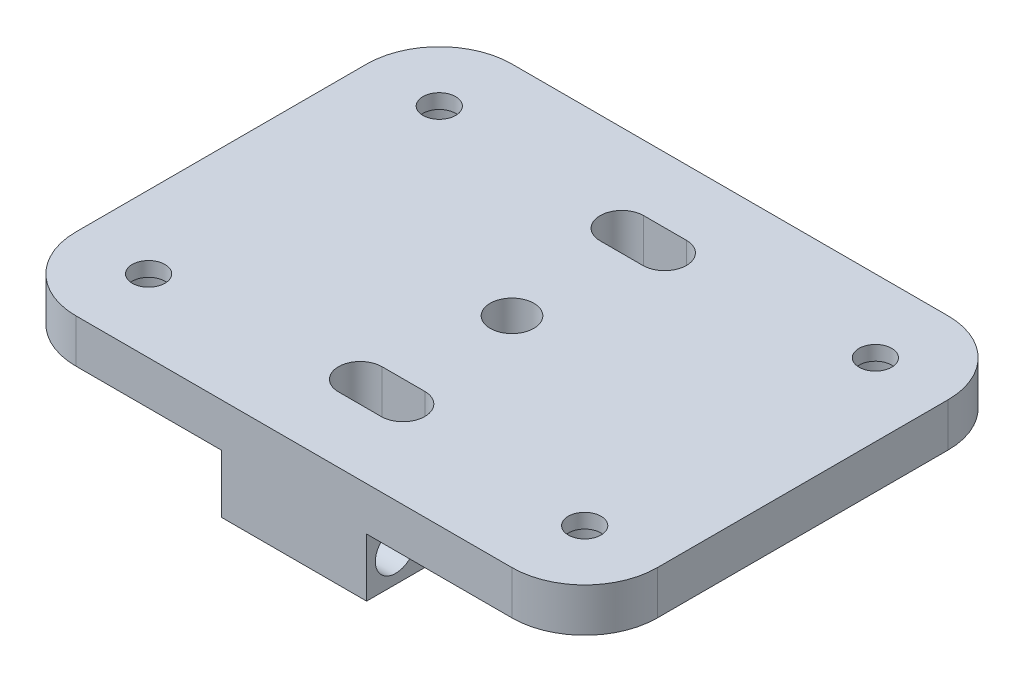
from build123d import *

# Parameters (mm, degrees)
ESQUISSE1_R              = 2.25
ESQUISSE1_R_2            = 3
BOSS_EXTRU_3_DEPTH       = 6
BOSS_EXTRU_4_START       = 8
ESQUISSE2_W              = 20
ESQUISSE2_H              = 60
ESQUISSE2_R              = 3
BOSS_EXTRU_4_DEPTH       = 8
ESQUISSE3_R              = 4
ENL_V_MAT_EXTRU_2_DEPTH  = 4
ESQUISSE7_R              = 2.8
ENL_V_MAT_EXTRU_8_DEPTH  = 8.1
ENL_V_MAT_EXTRU_9_DEPTH  = 52.923019943
ESQUISSE9_R              = 2.8
ENL_V_MAT_EXTRU_10_DEPTH = 8.1


with BuildPart() as part:
    # Esquisse1 → Boss.-Extru.3 (new body)
    with BuildSketch(Plane(origin=(0, 0, 0), x_dir=(1, 0, 0), z_dir=(0, 1, 0))):
        with BuildLine():
            Line((-29.104707822, 30), (-30, 30))
            ThreePointArc((-30, 30), (-37.071067812, 27.071067812), (-40, 20))
            Line((-40, 20), (-40, -20))
            ThreePointArc((-40, -20), (-37.071067812, -27.071067812), (-30, -30))
            Line((-30, -30), (-29.104707822, -30))
            Line((-29.104707822, -30), (-9.104707822, -30))
            Line((-9.104707822, -30), (30, -30))
            ThreePointArc((30, -30), (37.071067812, -27.071067812), (40, -20))
            Line((40, -20), (40, 20))
            ThreePointArc((40, 20), (37.071067812, 27.071067812), (30, 30))
            Line((30, 30), (-9.104707822, 30))
            Line((-9.104707822, 30), (-29.104707822, 30))
        make_face()
        with Locations((-30, -20)):
            Circle(ESQUISSE1_R, mode=Mode.SUBTRACT)
        with Locations((30, -20)):
            Circle(ESQUISSE1_R, mode=Mode.SUBTRACT)
        Circle(ESQUISSE1_R_2, mode=Mode.SUBTRACT)
        with Locations((-30, 20)):
            Circle(ESQUISSE1_R, mode=Mode.SUBTRACT)
        with Locations((30, 20)):
            Circle(ESQUISSE1_R, mode=Mode.SUBTRACT)
    extrude(amount=BOSS_EXTRU_3_DEPTH)

    # Esquisse2 → Boss.-Extru.4 (add)
    with BuildSketch(Plane.XZ.offset(BOSS_EXTRU_4_START)):
        Rectangle(ESQUISSE2_W, ESQUISSE2_H)
        Circle(ESQUISSE2_R, mode=Mode.SUBTRACT)
    extrude(amount=-BOSS_EXTRU_4_DEPTH)

    # Esquisse3 → Enlèv. mat.-Extru.2 (cut)
    with BuildSketch(Plane.XZ):
        with Locations((-30, 20)):
            Circle(ESQUISSE3_R)
        with Locations((-30, -20)):
            Circle(ESQUISSE3_R)
        with Locations((30, 20)):
            Circle(ESQUISSE3_R)
        with Locations((30, -20)):
            Circle(ESQUISSE3_R)
    extrude(amount=-ENL_V_MAT_EXTRU_2_DEPTH, mode=Mode.SUBTRACT)

    # Esquisse7 → Enlèv. mat.-Extru.8 (cut)
    with BuildSketch(Plane.ZY.offset(10)):
        with Locations((26, -3.87740141)):
            Circle(ESQUISSE7_R)
        with Locations((-26, -3.87740141)):
            Circle(ESQUISSE7_R)
    extrude(amount=-ENL_V_MAT_EXTRU_8_DEPTH, mode=Mode.SUBTRACT)

    # Esquisse8 → Enlèv. mat.-Extru.9 (cut, through all)
    with BuildSketch(Plane.XZ.offset(8)):
        with BuildLine():
            Line((-2.879526134, 21), (3, 21))
            ThreePointArc((3, 21), (6, 18), (3, 15))
            Line((3, 15), (-2.879526134, 15))
            ThreePointArc((-2.879526134, 15), (-5.879526134, 18), (-2.879526134, 21))
        make_face()
        with BuildLine():
            Line((-2.879526134, -15), (3, -15))
            ThreePointArc((3, -15), (6, -18), (3, -21))
            Line((3, -21), (-2.879526134, -21))
            ThreePointArc((-2.879526134, -21), (-5.879526134, -18), (-2.879526134, -15))
        make_face()
    extrude(amount=-ENL_V_MAT_EXTRU_9_DEPTH, mode=Mode.SUBTRACT)

    # Esquisse9 → Enlèv. mat.-Extru.10 (cut)
    with BuildSketch(Plane(origin=(10, 0, 0), x_dir=(0, 0, -1), z_dir=(1, 0, 0))):
        with Locations((-26, -3.88)):
            Circle(ESQUISSE9_R)
        with Locations((26, -3.88)):
            Circle(ESQUISSE9_R)
    extrude(amount=-ENL_V_MAT_EXTRU_10_DEPTH, mode=Mode.SUBTRACT)


solid = part.part
